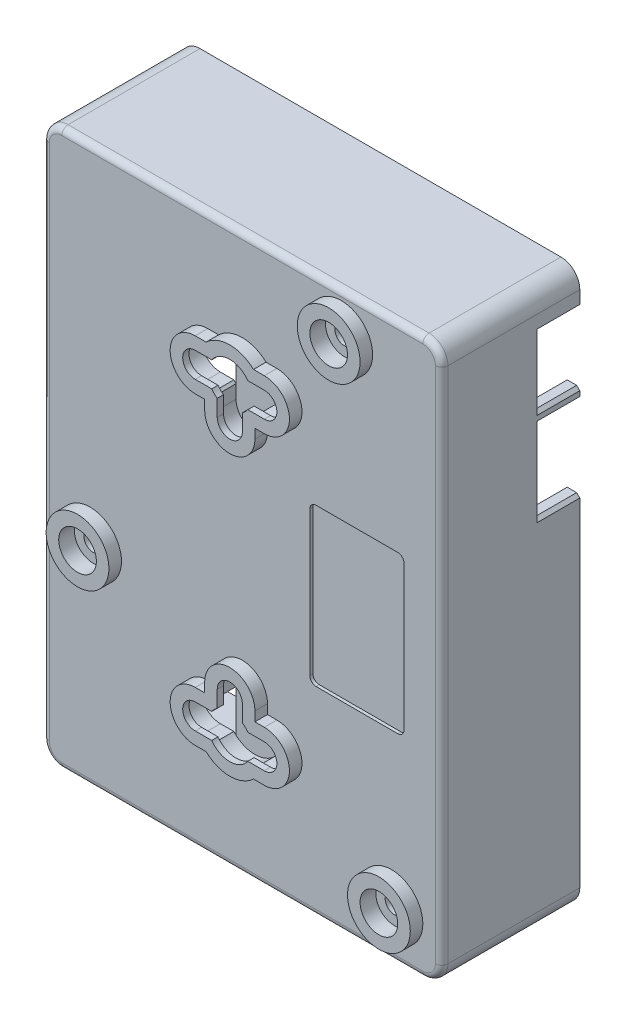
from build123d import *

# Parameters (mm, degrees)
SKETCH2_W            = 63.5
SKETCH2_H            = 88.5
BOSS_EXTRUDE1_DEPTH  = 2
SKETCH3_W            = 63.5
SKETCH3_H            = 88.5
SKETCH3_W_2          = 59.5
SKETCH3_H_2          = 84.5
BOSS_EXTRUDE2_DEPTH  = 20
SKETCH4_W            = 6.35
SKETCH4_H            = 13
SKETCH4_H_2          = 10.9
CUT_EXTRUDE1_DEPTH   = 2
CHAMFER1_SIZE        = 0.5
SKETCH5_R            = 0.75
SKETCH5_W            = 6.35
SKETCH5_H            = 25
CUT_EXTRUDE3_DEPTH   = 2
FILLET1_R            = 6
SKETCH6_W            = 26.800079737
SKETCH6_H            = 6.35
CUT_EXTRUDE4_DEPTH   = 2
FILLET2_R            = 3
CUT_EXTRUDE5_DEPTH   = 10
BOSS_EXTRUDE3_START  = 2
BOSS_EXTRUDE3_DEPTH  = 2
SKETCH9_R            = 3.5
SKETCH9_R_2          = 2.5
BOSS_EXTRUDE4_DEPTH  = 12.05
SKETCH10_R           = 1.5
CUT_EXTRUDE6_DEPTH   = 76.534322501
SKETCH11_R           = 3
CUT_EXTRUDE7_DEPTH   = 0.5
BOSS_EXTRUDE5_START  = 2
SKETCH12_R           = 5
SKETCH12_R_2         = 3
BOSS_EXTRUDE5_DEPTH  = 2
CUT_EXTRUDE8_DEPTH   = 3
BOSS_EXTRUDE6_DEPTH  = 5
FILLET3_R            = 2
FILLET3_OF_MIRROR2_R = 2
FILLET4_R            = 1
CUT_EXTRUDE9_DEPTH   = 0.5


with BuildPart() as part:
    # Sketch2 → Boss-Extrude1 (new body)
    with BuildSketch(Plane.XY.offset(2)):
        with Locations((-8.071244, 16.046786)):
            Rectangle(SKETCH2_W, SKETCH2_H)
    extrude(amount=BOSS_EXTRUDE1_DEPTH)

    # Sketch3 → Boss-Extrude2 (add)
    with BuildSketch(Plane(origin=(0, 0, 2), x_dir=(-1, 0, 0), z_dir=(0, 0, -1))):
        with Locations((8.071244, 16.046786)):
            Rectangle(SKETCH3_W, SKETCH3_H)
        with Locations((8.071244, 16.046786)):
            Rectangle(SKETCH3_W_2, SKETCH3_H_2, mode=Mode.SUBTRACT)
    extrude(amount=BOSS_EXTRUDE2_DEPTH)

    # Sketch4 → Cut-Extrude1 (cut)
    with BuildSketch(Plane(origin=(23.678756, 0, 0), x_dir=(0, 0, -1), z_dir=(1, 0, 0))):
        with Locations((14.825, 35.546786)):
            Rectangle(SKETCH4_W, SKETCH4_H)
        with Locations((14.825, 49.296786)):
            Rectangle(SKETCH4_W, SKETCH4_H_2)
    extrude(amount=-CUT_EXTRUDE1_DEPTH, mode=Mode.SUBTRACT)

    # Chamfer1
    chamfer1_edges = [part.edges().sort_by_distance(p)[0] for p in [
        (23.678756, 42.046786, -14.825),
        (23.678756, 35.546786, -11.65),
        (23.678756, 29.046786, -14.825),
        (23.678756, 54.746786, -14.825),
        (23.678756, 49.296786, -11.65),
        (23.678756, 43.846786, -14.825),
    ]]
    chamfer(chamfer1_edges, length=CHAMFER1_SIZE)

    # Sketch5 → Cut-Extrude3 (cut)
    with BuildSketch(Plane.ZY.offset(39.821244)):
        with Locations(Location((-12.431991388, 40.654286, 0), (0, 0, 270))):
            Circle(SKETCH5_R)
        with Locations((-14.825, 21.706977335)):
            Rectangle(SKETCH5_W, SKETCH5_H)
    extrude(amount=-CUT_EXTRUDE3_DEPTH, mode=Mode.SUBTRACT)

    # Fillet1
    fillet1_edges = [part.edges().sort_by_distance(p)[0] for p in [
        (-38.821244, 34.206977335, -18),
        (-38.821244, 9.206977335, -18),
    ]]
    fillet(fillet1_edges, radius=FILLET1_R)

    # Sketch6 → Cut-Extrude4 (cut)
    with BuildSketch(Plane.XZ.offset(28.203214)):
        with Locations((-0.390288681, -14.825)):
            Rectangle(SKETCH6_W, SKETCH6_H)
    extrude(amount=-CUT_EXTRUDE4_DEPTH, mode=Mode.SUBTRACT)

    # Fillet2
    fillet2_edges = [part.edges().sort_by_distance(p)[0] for p in [
        (-39.821244, 60.296786, -7),
        (23.678756, 60.296786, -7),
        (23.678756, -28.203214, -7),
        (-39.821244, -28.203214, -7),
    ]]
    fillet(fillet2_edges, radius=FILLET2_R)

    # Sketch7 → Cut-Extrude5 (cut)
    with BuildSketch(Plane.XY.offset(4)):
        with BuildLine():
            Line((-2.571244, -10.203214), (-5.198962677, -10.203214))
            ThreePointArc((-5.198962677, -10.203214), (-8.071244, -11.703214), (-10.943525323, -10.203214))
            Line((-10.943525323, -10.203214), (-13.571244, -10.203214))
            ThreePointArc((-13.571244, -10.203214), (-15.571244, -8.203214), (-13.571244, -6.203214))
            Line((-13.571244, -6.203214), (-10.943525323, -6.203214))
            ThreePointArc((-10.943525323, -6.203214), (-10.546117734, -5.728340266), (-10.071244, -5.330932677))
            Line((-10.071244, -5.330932677), (-10.071244, -2.703214))
            ThreePointArc((-10.071244, -2.703214), (-8.071244, -0.703214), (-6.071244, -2.703214))
            Line((-6.071244, -2.703214), (-6.071244, -5.330932677))
            ThreePointArc((-6.071244, -5.330932677), (-5.596370266, -5.728340266), (-5.198962677, -6.203214))
            Line((-5.198962677, -6.203214), (-2.571244, -6.203214))
            ThreePointArc((-2.571244, -6.203214), (-0.571244, -8.203214), (-2.571244, -10.203214))
        make_face()
        with BuildLine():
            Line((-6.071244, 34.796786), (-6.071244, 37.424504677))
            ThreePointArc((-6.071244, 37.424504677), (-5.596370266, 37.821912266), (-5.198962677, 38.296786))
            Line((-5.198962677, 38.296786), (-2.571244, 38.296786))
            ThreePointArc((-2.571244, 38.296786), (-0.571244, 40.296786), (-2.571244, 42.296786))
            Line((-2.571244, 42.296786), (-5.198962677, 42.296786))
            ThreePointArc((-5.198962677, 42.296786), (-8.071244, 43.796786), (-10.943525323, 42.296786))
            Line((-10.943525323, 42.296786), (-13.571244, 42.296786))
            ThreePointArc((-13.571244, 42.296786), (-15.571244, 40.296786), (-13.571244, 38.296786))
            Line((-13.571244, 38.296786), (-10.943525323, 38.296786))
            ThreePointArc((-10.943525323, 38.296786), (-10.546117734, 37.821912266), (-10.071244, 37.424504677))
            Line((-10.071244, 37.424504677), (-10.071244, 34.796786))
            ThreePointArc((-10.071244, 34.796786), (-8.071244, 32.796786), (-6.071244, 34.796786))
        make_face()
    extrude(amount=-CUT_EXTRUDE5_DEPTH, mode=Mode.SUBTRACT)

    # Sketch8 → Boss-Extrude3 (add)
    with BuildSketch(Plane.XY.offset(4).offset(BOSS_EXTRUDE3_START)):
        with BuildLine():
            Line((-11.846161218, 44.296786), (-13.571244, 44.296786))
            ThreePointArc((-13.571244, 44.296786), (-17.571244, 40.296786), (-13.571244, 36.296786))
            Line((-13.571244, 36.296786), (-12.071244, 36.296786))
            Line((-12.071244, 36.296786), (-12.071244, 34.796786))
            ThreePointArc((-12.071244, 34.796786), (-8.071244, 30.796786), (-4.071244, 34.796786))
            Line((-4.071244, 34.796786), (-4.071244, 36.296786))
            Line((-4.071244, 36.296786), (-2.571244, 36.296786))
            ThreePointArc((-2.571244, 36.296786), (1.428756, 40.296786), (-2.571244, 44.296786))
            Line((-2.571244, 44.296786), (-4.296326782, 44.296786))
            ThreePointArc((-4.296326782, 44.296786), (-8.071244, 45.796786), (-11.846161218, 44.296786))
        make_face()
        with BuildLine():
            Line((-2.571244, 42.296786), (-5.198962677, 42.296786))
            ThreePointArc((-5.198962677, 42.296786), (-8.071244, 43.796786), (-10.943525323, 42.296786))
            Line((-10.943525323, 42.296786), (-13.571244, 42.296786))
            ThreePointArc((-13.571244, 42.296786), (-15.571244, 40.296786), (-13.571244, 38.296786))
            Line((-13.571244, 38.296786), (-10.943525323, 38.296786))
            ThreePointArc((-10.943525323, 38.296786), (-10.546117734, 37.821912266), (-10.071244, 37.424504677))
            Line((-10.071244, 37.424504677), (-10.071244, 34.796786))
            ThreePointArc((-10.071244, 34.796786), (-8.071244, 32.796786), (-6.071244, 34.796786))
            Line((-6.071244, 34.796786), (-6.071244, 37.424504677))
            ThreePointArc((-6.071244, 37.424504677), (-5.596370266, 37.821912266), (-5.198962677, 38.296786))
            Line((-5.198962677, 38.296786), (-2.571244, 38.296786))
            ThreePointArc((-2.571244, 38.296786), (-0.571244, 40.296786), (-2.571244, 42.296786))
        make_face(mode=Mode.SUBTRACT)
    boss_extrude3 = extrude(amount=-BOSS_EXTRUDE3_DEPTH)

    # Sketch9 → Boss-Extrude4 (add)
    with BuildSketch(Plane(origin=(0, 0, 2), x_dir=(-1, 0, 0), z_dir=(0, 0, -1))):
        with Locations(Location((-15.678756, -20.703214, 0), (0, 0, 180))):
            Circle(SKETCH9_R)
        with Locations(Location((32.321244, 5.296786, 0), (0, 0, 180))):
            Circle(SKETCH9_R)
        with Locations(Location((-7.678756, 53.796786, 0), (0, 0, 180))):
            Circle(SKETCH9_R_2)
    extrude(amount=BOSS_EXTRUDE4_DEPTH)

    # Sketch10 → Cut-Extrude6 (cut, through all)
    with BuildSketch(Plane.XY.offset(4)):
        with Locations((7.678756, 53.796786)):
            Circle(SKETCH10_R)
        with Locations((15.678756, -20.703214)):
            Circle(SKETCH10_R)
        with Locations((-32.321244, 5.296786)):
            Circle(SKETCH10_R)
    extrude(amount=-CUT_EXTRUDE6_DEPTH, mode=Mode.SUBTRACT)

    # Sketch11 → Cut-Extrude7 (cut)
    with BuildSketch(Plane.XY.offset(4)):
        with Locations((7.678756, 53.796786)):
            Circle(SKETCH11_R)
        with Locations((-32.321244, 5.296786)):
            Circle(SKETCH11_R)
        with Locations((15.678756, -20.703214)):
            Circle(SKETCH11_R)
    extrude(amount=-CUT_EXTRUDE7_DEPTH, mode=Mode.SUBTRACT)

    # Sketch12 → Boss-Extrude5 (add)
    # profile 1 of 3: a face of its own
    with BuildSketch(Plane.XY.offset(4).offset(BOSS_EXTRUDE5_START)):
        with Locations((7.678756, 53.796786)):
            Circle(SKETCH12_R)
        with Locations((7.678756, 53.796786)):
            Circle(SKETCH12_R_2, mode=Mode.SUBTRACT)
    # profile 2 of 3: a face of its own
    with BuildSketch(Plane.XY.offset(4).offset(BOSS_EXTRUDE5_START)):
        with Locations((-32.321244, 5.296786)):
            Circle(SKETCH12_R)
        with Locations((-32.321244, 5.296786)):
            Circle(SKETCH12_R_2, mode=Mode.SUBTRACT)
    # profile 3 of 3: a face of its own
    with BuildSketch(Plane.XY.offset(4).offset(BOSS_EXTRUDE5_START)):
        with Locations((15.678756, -20.703214)):
            Circle(SKETCH12_R)
        with Locations((15.678756, -20.703214)):
            Circle(SKETCH12_R_2, mode=Mode.SUBTRACT)
    extrude(amount=-BOSS_EXTRUDE5_DEPTH)

    # Sketch13 → Cut-Extrude8 (cut)
    with BuildSketch(Plane(origin=(0, 0, 2), x_dir=(-1, 0, 0), z_dir=(0, 0, -1))):
        with BuildLine():
            Line((13.571244, 43.296786), (11.425345966, 43.296786))
            ThreePointArc((11.425345966, 43.296786), (8.071244, 44.796786), (4.717142034, 43.296786))
            Line((4.717142034, 43.296786), (2.571244, 43.296786))
            ThreePointArc((2.571244, 43.296786), (-0.428756, 40.296786), (2.571244, 37.296786))
            Line((2.571244, 37.296786), (4.717142034, 37.296786))
            ThreePointArc((4.717142034, 37.296786), (4.889263485, 37.114805485), (5.071244, 36.942684034))
            Line((5.071244, 36.942684034), (5.071244, 34.796786))
            ThreePointArc((5.071244, 34.796786), (8.071244, 31.796786), (11.071244, 34.796786))
            Line((11.071244, 34.796786), (11.071244, 36.942684034))
            ThreePointArc((11.071244, 36.942684034), (11.253224515, 37.114805485), (11.425345966, 37.296786))
            Line((11.425345966, 37.296786), (13.571244, 37.296786))
            ThreePointArc((13.571244, 37.296786), (16.571244, 40.296786), (13.571244, 43.296786))
        make_face()
    cut_extrude8 = extrude(amount=-CUT_EXTRUDE8_DEPTH, mode=Mode.SUBTRACT)

    # Mirror1: Boss-Extrude3, Cut-Extrude8 across plane
    add(boss_extrude3.mirror(Plane.ZX.offset(16.046786)))
    add(cut_extrude8.mirror(Plane.ZX.offset(16.046786)), mode=Mode.SUBTRACT)

    # Sketch14 → Boss-Extrude6 (add, symmetric)
    with BuildSketch(Plane(origin=(-8.071244, 0, 0), x_dir=(0, 0, -1), z_dir=(1, 0, 0))):
        Polygon((-2, 48.796786), (2, 48.796786), (2, 27.796786), (-2, 27.796786), (-2, 29.796786), (0, 29.796786), (0, 46.796786), (-2, 46.796786), align=None)
    boss_extrude6 = extrude(amount=BOSS_EXTRUDE6_DEPTH, both=True)

    # Fillet3
    fillet3_edges = [part.edges().sort_by_distance(p)[0] for p in [
        (-8.071244, 27.796786, 2),
        (-8.071244, 48.796786, 2),
    ]]
    fillet(fillet3_edges, radius=FILLET3_R)
    fillet3_2_edges = [part.edges().sort_by_distance(p)[0] for p in [
        (-8.071244, 27.796786, -2),
        (-8.071244, 48.796786, -2),
    ]]
    fillet(fillet3_2_edges, radius=FILLET3_R - 0.0001)  # a hair under: the kernel refuses the full size

    # Mirror2: Boss-Extrude6 across plane
    add(boss_extrude6.mirror(Plane.ZX.offset(16.046786)))

    # Fillet3 of Mirror2
    fillet3_of_mirror2_edges = [part.edges().sort_by_distance(p)[0] for p in [
        (-8.071244, 4.296786, 2),
        (-8.071244, -16.703214, 2),
    ]]
    fillet(fillet3_of_mirror2_edges, radius=FILLET3_OF_MIRROR2_R)
    fillet3_of_mirror2_2_edges = [part.edges().sort_by_distance(p)[0] for p in [
        (-8.071244, 4.296786, -2),
        (-8.071244, -16.703214, -2),
    ]]
    fillet(fillet3_of_mirror2_2_edges, radius=FILLET3_OF_MIRROR2_R - 0.0001)  # a hair under: the kernel refuses the full size

    # Fillet4
    fillet4_edges = [part.edges().sort_by_distance(p)[0] for p in [
        (-39.821244, 16.046786, 4),
        (-8.071244, 60.296786, 4),
        (-8.071244, -28.203214, 4),
        (23.678756, 16.046786, 4),
        (-38.942564344, -27.324534344, 4),
        (22.800076344, -27.324534344, 4),
        (22.800076344, 59.418106344, 4),
        (-38.942564344, 59.418106344, 4),
    ]]
    fillet(fillet4_edges, radius=FILLET4_R)

    # Sketch15 → Cut-Extrude9 (cut)
    with BuildSketch(Plane.XY.offset(4)):
        with BuildLine():
            Line((3.678756, 28.546786), (16.678756, 28.546786))
            ThreePointArc((16.678756, 28.546786), (17.385862781, 28.253892781), (17.678756, 27.546786))
            Line((17.678756, 27.546786), (17.678756, 4.546786))
            ThreePointArc((17.678756, 4.546786), (17.385862781, 3.839679219), (16.678756, 3.546786))
            Line((16.678756, 3.546786), (3.678756, 3.546786))
            ThreePointArc((3.678756, 3.546786), (2.971649219, 3.839679219), (2.678756, 4.546786))
            Line((2.678756, 4.546786), (2.678756, 27.546786))
            ThreePointArc((2.678756, 27.546786), (2.971649219, 28.253892781), (3.678756, 28.546786))
        make_face()
    extrude(amount=-CUT_EXTRUDE9_DEPTH, mode=Mode.SUBTRACT)


solid = part.part
